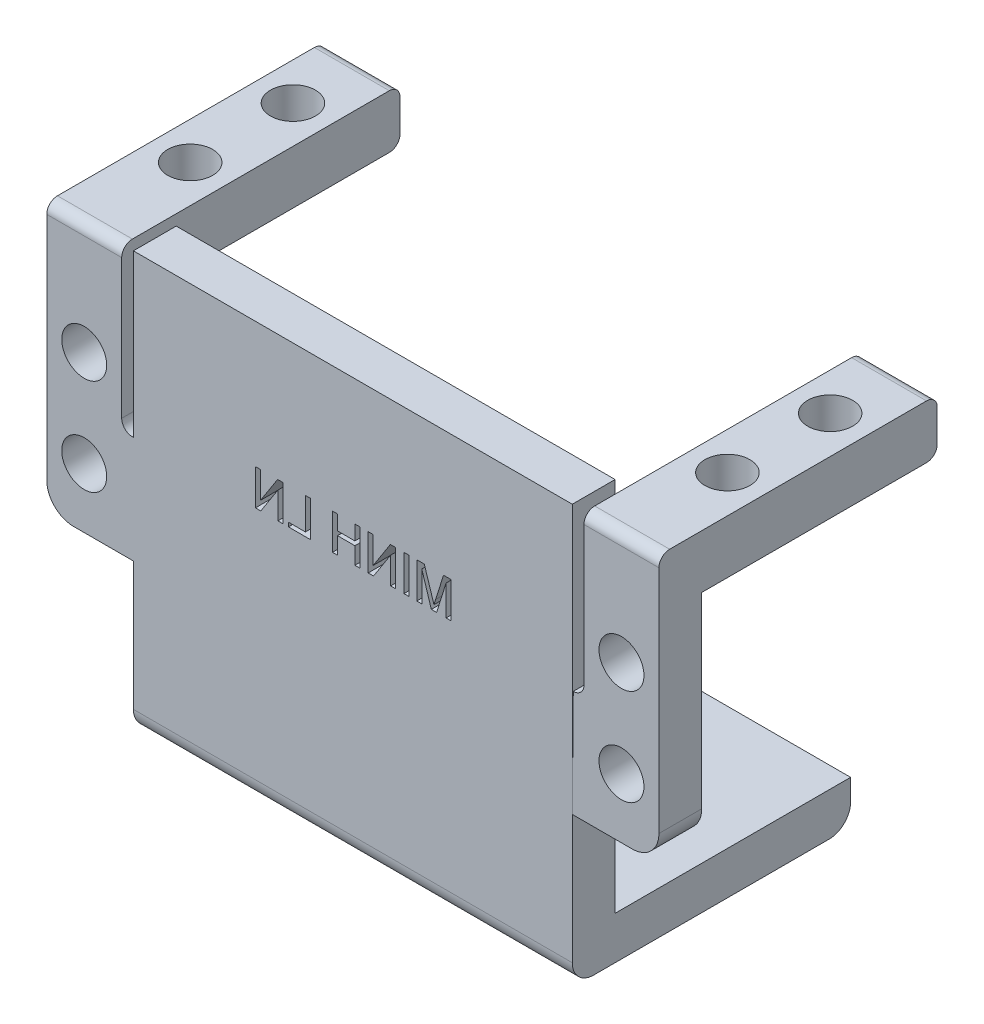
from build123d import *

# Parameters (mm, degrees)
SKETCH1_W            = 41
SKETCH1_H            = 37
BOSS_EXTRUDE2_DEPTH  = 4
BOSS_EXTRUDE5_DEPTH  = 7
BOSS_EXTRUDE6_START  = -7
BOSS_EXTRUDE6_DEPTH  = 7
BOSS_EXTRUDE7_DEPTH  = 41
SKETCH6_R            = 2.1
CUT_EXTRUDE1_DEPTH   = 41
VENT3_START          = -3
VENT3_DEPTH          = 3
VENT3_START_2        = -2
VENT3_2_DEPTH        = 2
SKETCH13_R           = 2.1
CUT_EXTRUDE4_DEPTH   = 41
WRAP2_START          = -4
WRAP2_OUTLINE_W      = 0.470858425
WRAP2_OUTLINE_H      = 3.33881429
WRAP2_DEPTH          = 4
SKETCH19_W           = 41
SKETCH19_H           = 4.905077857
CUT_EXTRUDE5_DEPTH   = 41
CUT_EXTRUDE10_DEPTH  = 49
BOSS_EXTRUDE8_DEPTH  = 41
CUT_EXTRUDE11_DEPTH  = 41
SKETCH25_W           = 4
SKETCH25_H           = 7
CUT_EXTRUDE12_DEPTH  = 41
BOSS_EXTRUDE10_DEPTH = 41
VENT5_START          = -7
VENT5_DEPTH          = 4


# Read off the part's stored shape, not the designer's step: Vent3, Wrap2, Vent5
with BuildPart() as part:
    # Sketch1 → Boss-Extrude2 (new body)
    with BuildSketch(Plane.XY):
        with BuildLine():
            Line((-5.593578953, 7), (0, 7))
            Line((0, 7), (0, 17))
            Line((0, 17), (-0.093578953, 17))
            ThreePointArc((-0.093578953, 17), (-0.800685735, 17.292893219), (-1.093578953, 18))
            Line((-1.093578953, 18), (-1.093578953, 27))
            Line((-1.093578953, 27), (-8.093578953, 27))
            Line((-8.093578953, 27), (-8.093578953, 9.5))
            ThreePointArc((-8.093578953, 9.5), (-7.361345906, 7.732233047), (-5.593578953, 7))
        make_face()
        with Locations((20.5, 18.5)):
            Rectangle(SKETCH1_W, SKETCH1_H)
        with BuildLine():
            Line((42.093578953, 27), (42.093578953, 18))
            ThreePointArc((42.093578953, 18), (41.800685735, 17.292893219), (41.093578953, 17))
            Line((41.093578953, 17), (41, 7))
            Line((41, 7), (46.593578953, 7))
            ThreePointArc((46.593578953, 7), (48.361345906, 7.732233047), (49.093578953, 9.5))
            Line((49.093578953, 9.5), (49.093578953, 27))
            Line((49.093578953, 27), (42.093578953, 27))
        make_face()
    extrude(amount=BOSS_EXTRUDE2_DEPTH)

    # Sketch3 → Boss-Extrude5 (add)
    with BuildSketch(Plane.ZY.offset(8.093578953)):
        with BuildLine():
            Line((4, 27), (4, 31))
            ThreePointArc((4, 31), (3.707106781, 31.707106781), (3, 32))
            Line((3, 32), (-21, 32))
            ThreePointArc((-21, 32), (-21.707106781, 31.707106781), (-22, 31))
            Line((-22, 31), (-22, 28))
            ThreePointArc((-22, 28), (-21.707106781, 27.292893219), (-21, 27))
            Line((-21, 27), (4, 27))
        make_face()
    extrude(amount=-BOSS_EXTRUDE5_DEPTH)

    # Sketch4 → Boss-Extrude6 (add)
    with BuildSketch(Plane(origin=(49.093578953, 0, 0), x_dir=(0, 0, -1), z_dir=(1, 0, 0)).offset(BOSS_EXTRUDE6_START)):
        with BuildLine():
            Line((-4, 27), (-4, 31))
            ThreePointArc((-4, 31), (-3.707106781, 31.707106781), (-3, 32))
            Line((-3, 32), (21, 32))
            ThreePointArc((21, 32), (21.707106781, 31.707106781), (22, 31))
            Line((22, 31), (22, 28))
            ThreePointArc((22, 28), (21.707106781, 27.292893219), (21, 27))
            Line((21, 27), (-4, 27))
        make_face()
    extrude(amount=BOSS_EXTRUDE6_DEPTH)

    # Sketch5 → Boss-Extrude7 (add)
    with BuildSketch(Plane(origin=(41, 0, 0), x_dir=(0, 0, -1), z_dir=(1, 0, 0))):
        with BuildLine():
            Line((-4, 0), (-4, -2))
            ThreePointArc((-4, -2), (-3.707106781, -2.707106781), (-3, -3))
            Line((-3, -3), (21, -3))
            ThreePointArc((21, -3), (21.707106781, -2.707106781), (22, -2))
            Line((22, -2), (22, 0))
            Line((22, 0), (-4, 0))
        make_face()
    extrude(amount=-BOSS_EXTRUDE7_DEPTH)

    # Sketch6 → Cut-Extrude1 (cut)
    with BuildSketch(Plane(origin=(0, 0, 0), x_dir=(-1, 0, 0), z_dir=(0, 0, -1))):
        with Locations((-45.593578953, 21.584624203)):
            Circle(SKETCH6_R)
        with Locations((-45.593578953, 12.584624203)):
            Circle(SKETCH6_R)
        with Locations(Location((4.593578953, 12.584624203, 0), (0, 0, 180))):
            Circle(SKETCH6_R)
        with Locations(Location((4.593578953, 21.584624203, 0), (0, 0, 180))):
            Circle(SKETCH6_R)
    extrude(amount=-CUT_EXTRUDE1_DEPTH, mode=Mode.SUBTRACT)

    # Vent3 outline → Vent3 (cut)
    with BuildSketch(Plane(origin=(0, 0, 0), x_dir=(1, 0, 0), z_dir=(0, 1, 0)).offset(VENT3_START)):
        with BuildLine():
            add(Edge.make_bspline(
                [(26.254292758, 14.292229622), (26.490329769, 14.024628481), (27.028597409, 13.325420144), (27.693645718, 12.081202271), (28.103180437, 10.731147229), (28.216982696, 9.856119597), (28.239301908, 9.499993666)],
                knots=[0.884953607, 0.884953607, 0.884953607, 0.884953607, 0.90625, 0.9375, 0.96875, 0.990046392, 0.990046392, 0.990046392, 0.990046392], degree=3))
            Line((26.254292758, 14.292229622), (25.191078107, 13.229005937))
            add(Edge.make_bspline(
                [(25.191078107, 13.229005937), (25.359316582, 13.032624281), (25.773380785, 12.486641347), (26.298893159, 11.503476846), (26.622502084, 10.436681188), (26.715782713, 9.75782534), (26.735682947, 9.499999964)],
                knots=[0.88725486, 0.88725486, 0.88725486, 0.88725486, 0.90625, 0.9375, 0.96875, 0.987745141, 0.987745141, 0.987745141, 0.987745141], degree=3))
            Line((26.735682947, 9.499999964), (28.239301908, 9.499993666))
        make_face()
        with BuildLine():
            add(Edge.make_bspline(
                [(20.754959005, 16.984336506), (21.111084958, 16.962017296), (21.986112614, 16.848215038), (23.336167677, 16.438680312), (24.580385232, 15.773632174), (25.279593317, 15.235364802), (25.547194221, 14.999328063)],
                knots=[0.759953607, 0.759953607, 0.759953607, 0.759953607, 0.78125, 0.8125, 0.84375, 0.865046372, 0.865046372, 0.865046372, 0.865046372], degree=3))
            Line((20.754959005, 16.984336506), (20.754965394, 15.48071754))
            add(Edge.make_bspline(
                [(20.754965394, 15.48071754), (21.012790761, 15.460817306), (21.691646601, 15.367536676), (22.758442251, 15.043927754), (23.741606759, 14.518415376), (24.287589698, 14.104351168), (24.48397136, 13.936112687)],
                knots=[0.76225486, 0.76225486, 0.76225486, 0.76225486, 0.78125, 0.8125, 0.84375, 0.86274514, 0.86274514, 0.86274514, 0.86274514], degree=3))
            Line((24.48397136, 13.936112687), (25.547194221, 14.999328063))
        make_face()
        with BuildLine():
            add(Edge.make_bspline(
                [(14.962735784, 14.999327352), (15.230336925, 15.235364364), (15.929545262, 15.773632004), (17.173763134, 16.438680312), (18.523817853, 16.848214934), (19.39884514, 16.962017204), (19.754970732, 16.984336439)],
                knots=[0.634953607, 0.634953607, 0.634953607, 0.634953607, 0.65625, 0.6875, 0.71875, 0.740046372, 0.740046372, 0.740046372, 0.740046372], degree=3))
            Line((14.962735784, 14.999327352), (16.025959469, 13.936112702))
            add(Edge.make_bspline(
                [(16.025959469, 13.936112702), (16.222341125, 14.104351177), (16.768324058, 14.518415379), (17.75148856, 15.043927754), (18.818284217, 15.367536678), (19.497140065, 15.460817308), (19.754965439, 15.480717542)],
                knots=[0.63725486, 0.63725486, 0.63725486, 0.63725486, 0.65625, 0.6875, 0.71875, 0.73774514, 0.73774514, 0.73774514, 0.73774514], degree=3))
            Line((19.754965439, 15.480717542), (19.754970732, 16.984336439))
        make_face()
        with BuildLine():
            add(Edge.make_bspline(
                [(12.270628899, 9.4999936), (12.292948109, 9.856119553), (12.406750367, 10.731147208), (12.816285093, 12.081202271), (13.481333232, 13.325419826), (14.019600604, 14.024627911), (14.255637342, 14.292228815)],
                knots=[0.509953607, 0.509953607, 0.509953607, 0.509953607, 0.53125, 0.5625, 0.59375, 0.615046372, 0.615046372, 0.615046372, 0.615046372], degree=3))
            Line((12.270628899, 9.4999936), (13.774247864, 9.499999971))
            add(Edge.make_bspline(
                [(13.774247864, 9.499999971), (13.794148098, 9.757825344), (13.887428728, 10.43668119), (14.211037652, 11.503476846), (14.73655003, 12.486641354), (15.150614238, 13.032624293), (15.318852718, 13.229005954)],
                knots=[0.51225486, 0.51225486, 0.51225486, 0.51225486, 0.53125, 0.5625, 0.59375, 0.61274514, 0.61274514, 0.61274514, 0.61274514], degree=3))
            Line((15.318852718, 13.229005954), (14.255637342, 14.292228815))
        make_face()
        with BuildLine():
            add(Edge.make_bspline(
                [(14.255638053, 3.707770378), (14.019601042, 3.975371519), (13.481333402, 4.674579856), (12.816285093, 5.918797729), (12.406750472, 7.268852447), (12.292948202, 8.143879735), (12.270628966, 8.500005327)],
                knots=[0.384953607, 0.384953607, 0.384953607, 0.384953607, 0.40625, 0.4375, 0.46875, 0.490046372, 0.490046372, 0.490046372, 0.490046372], degree=3))
            Line((14.255638053, 3.707770378), (15.318852715, 4.77099405))
            add(Edge.make_bspline(
                [(15.318852715, 4.77099405), (15.150614236, 4.96737571), (14.736550029, 5.513358648), (14.211037652, 6.496523154), (13.887428727, 7.563318811), (13.794148098, 8.242174659), (13.774247864, 8.500000034)],
                knots=[0.38725486, 0.38725486, 0.38725486, 0.38725486, 0.40625, 0.4375, 0.46875, 0.48774514, 0.48774514, 0.48774514, 0.48774514], degree=3))
            Line((13.774247864, 8.500000034), (12.270628966, 8.500005327))
        make_face()
        with BuildLine():
            add(Edge.make_bspline(
                [(19.754971805, 1.015663494), (19.398845853, 1.037982704), (18.523818197, 1.151784962), (17.173763134, 1.561319688), (15.929545579, 2.226367826), (15.230337494, 2.764635198), (14.96273659, 3.000671937)],
                knots=[0.259953607, 0.259953607, 0.259953607, 0.259953607, 0.28125, 0.3125, 0.34375, 0.365046372, 0.365046372, 0.365046372, 0.365046372], degree=3))
            Line((19.754971805, 1.015663494), (19.754965434, 2.519282459))
            add(Edge.make_bspline(
                [(19.754965434, 2.519282459), (19.497140061, 2.539182693), (18.818284215, 2.632463322), (17.75148856, 2.956072246), (16.768324057, 3.481584622), (16.222341122, 3.895648825), (16.025959465, 4.063887302)],
                knots=[0.26225486, 0.26225486, 0.26225486, 0.26225486, 0.28125, 0.3125, 0.34375, 0.36274514, 0.36274514, 0.36274514, 0.36274514], degree=3))
            Line((16.025959465, 4.063887302), (14.96273659, 3.000671937))
        make_face()
        with BuildLine():
            add(Edge.make_bspline(
                [(25.547195027, 3.000672648), (25.279593886, 2.764635636), (24.580385549, 2.226367996), (23.336167677, 1.561319688), (21.986112958, 1.151785066), (21.111085671, 1.037982796), (20.754960079, 1.015663561)],
                knots=[0.134953607, 0.134953607, 0.134953607, 0.134953607, 0.15625, 0.1875, 0.21875, 0.240046372, 0.240046372, 0.240046372, 0.240046372], degree=3))
            Line((25.547195027, 3.000672648), (24.483971356, 4.063887309))
            add(Edge.make_bspline(
                [(24.483971356, 4.063887309), (24.287589695, 3.89564883), (23.741606758, 3.481584624), (22.758442251, 2.956072246), (21.6916466, 2.632463323), (21.012790758, 2.539182694), (20.754965389, 2.51928246)],
                knots=[0.13725486, 0.13725486, 0.13725486, 0.13725486, 0.15625, 0.1875, 0.21875, 0.23774514, 0.23774514, 0.23774514, 0.23774514], degree=3))
            Line((20.754965389, 2.51928246), (20.754960079, 1.015663561))
        make_face()
        with BuildLine():
            add(Edge.make_bspline(
                [(28.239301849, 8.500005394), (28.216982615, 8.143879779), (28.103180346, 7.268852469), (27.693645718, 5.918797729), (27.028597579, 4.674580174), (26.490330207, 3.975372089), (26.254293469, 3.707771185)],
                knots=[0.009953627, 0.009953627, 0.009953627, 0.009953627, 0.03125, 0.0625, 0.09375, 0.115046372, 0.115046372, 0.115046372, 0.115046372], degree=3))
            Line((28.239301849, 8.500005394), (26.735682947, 8.500000028))
            add(Edge.make_bspline(
                [(26.735682947, 8.500000028), (26.715782713, 8.242174655), (26.622502083, 7.56331881), (26.298893159, 6.496523154), (25.773380784, 5.513358651), (25.35931658, 4.967375716), (25.191078104, 4.770994059)],
                knots=[0.01225486, 0.01225486, 0.01225486, 0.01225486, 0.03125, 0.0625, 0.09375, 0.11274514, 0.11274514, 0.11274514, 0.11274514], degree=3))
            Line((25.191078104, 4.770994059), (26.254293469, 3.707771185))
        make_face()
        with BuildLine():
            add(Edge.make_bspline(
                [(23.719578667, 8.5), (23.710818691, 8.438795946), (23.661877779, 8.151934077), (23.508858699, 7.652344268), (23.263786163, 7.190727584), (23.09555819, 6.953268745), (23.058387959, 6.903684228)],
                knots=[0.022808357, 0.022808357, 0.022808357, 0.022808357, 0.031243519, 0.062499749, 0.093737042, 0.102191544, 0.102191544, 0.102191544, 0.102191544], degree=3))
            Line((23.719578667, 8.5), (22.191357776, 8.50004854))
            add(Edge.make_bspline(
                [(22.191357776, 8.50004854), (22.168050259, 8.409645315), (22.108840924, 8.232097408), (22.02516265, 8.064684867), (21.977717536, 7.984277617)],
                knots=[0.040212611, 0.040212611, 0.040212611, 0.040212611, 0.0625, 0.084787876, 0.084787876, 0.084787876, 0.084787876], degree=3))
            Line((21.977717536, 7.984277617), (23.058387959, 6.903684228))
        make_face()
        with BuildLine():
            Line((25.732169626, 8.500000021), (24.727084946, 8.500005812))
            add(Edge.make_bspline(
                [(24.727084946, 8.500005812), (24.712919427, 8.373280452), (24.648235027, 7.955843767), (24.439223081, 7.266823722), (24.099805769, 6.631818594), (23.850371742, 6.290906996), (23.770779433, 6.191281592)],
                knots=[0.017720318, 0.017720318, 0.017720318, 0.017720318, 0.03125, 0.0625, 0.09375, 0.107279756, 0.107279756, 0.107279756, 0.107279756], degree=3))
            Line((23.770779433, 6.191281592), (24.481487035, 5.480585138))
            add(Edge.make_bspline(
                [(25.732169626, 8.500000021), (25.714614891, 8.307722769), (25.635375377, 7.759603777), (25.36905812, 6.881673438), (24.936582364, 6.072568207), (24.605034509, 5.628958757), (24.481487035, 5.480585138)],
                knots=[0.014488699, 0.014488699, 0.014488699, 0.014488699, 0.03125, 0.0625, 0.09375, 0.110511301, 0.110511301, 0.110511301, 0.110511301], degree=3))
        make_face()
        with BuildLine():
            add(Edge.make_bspline(
                [(23.058389576, 11.096317403), (23.095447527, 11.046882155), (23.263690757, 10.809436942), (23.508738524, 10.347907918), (23.661914695, 9.848167792), (23.710860564, 9.561300711), (23.71963087, 9.5)],
                knots=[0.897807983, 0.897807983, 0.897807983, 0.897807983, 0.906237042, 0.937499748, 0.968743523, 0.977191918, 0.977191918, 0.977191918, 0.977191918], degree=3))
            Line((23.058389576, 11.096317403), (21.977719483, 10.015719084))
            add(Edge.make_bspline(
                [(21.977719483, 10.015719084), (22.025163794, 9.935312843), (22.108842588, 9.767898861), (22.16805204, 9.590349345), (22.191359879, 9.499943302)],
                knots=[0.915212428, 0.915212428, 0.915212428, 0.915212428, 0.9375, 0.959788059, 0.959788059, 0.959788059, 0.959788059], degree=3))
            Line((22.191359879, 9.499943302), (23.71963087, 9.5))
        make_face()
        with BuildLine():
            Line((24.48148704, 12.519414856), (23.770779936, 11.808717778))
            add(Edge.make_bspline(
                [(23.770779936, 11.808717778), (23.850372059, 11.70909257), (24.099805896, 11.368181168), (24.439223081, 10.733176278), (24.648235356, 10.044155147), (24.712919773, 9.626717314), (24.727085322, 9.499990821)],
                knots=[0.892720273, 0.892720273, 0.892720273, 0.892720273, 0.90625, 0.9375, 0.96875, 0.982279802, 0.982279802, 0.982279802, 0.982279802], degree=3))
            Line((24.727085322, 9.499990821), (25.732169627, 9.499999973))
            add(Edge.make_bspline(
                [(24.48148704, 12.519414856), (24.605034512, 12.371041239), (24.936582365, 11.92743179), (25.36905812, 11.118326562), (25.635375377, 10.240396221), (25.714614891, 9.692277227), (25.732169627, 9.499999973)],
                knots=[0.889488699, 0.889488699, 0.889488699, 0.889488699, 0.90625, 0.9375, 0.96875, 0.985511301, 0.985511301, 0.985511301, 0.985511301], degree=3))
        make_face()
        with BuildLine():
            add(Edge.make_bspline(
                [(20.754965395, 12.464639674), (20.816125233, 12.455887713), (21.102990751, 12.406955608), (21.602575841, 12.253904173), (22.064238, 12.008820256), (22.301697051, 11.840593302), (22.351281681, 11.803423056)],
                knots=[0.772808003, 0.772808003, 0.772808003, 0.772808003, 0.781237042, 0.812499748, 0.843737042, 0.852191567, 0.852191567, 0.852191567, 0.852191567], degree=3))
            Line((20.754965395, 12.464639674), (20.754914644, 10.936392943))
            add(Edge.make_bspline(
                [(20.754914644, 10.936392943), (20.845318636, 10.913085339), (21.022867311, 10.853875862), (21.190280535, 10.770197246), (21.270687785, 10.722752133)],
                knots=[0.790212428, 0.790212428, 0.790212428, 0.790212428, 0.8125, 0.834787876, 0.834787876, 0.834787876, 0.834787876], degree=3))
            Line((21.270687785, 10.722752133), (22.351281681, 11.803423056))
        make_face()
        with BuildLine():
            Line((20.754965404, 14.477204219), (20.754958314, 13.472119683))
            add(Edge.make_bspline(
                [(20.754958314, 13.472119683), (20.881684104, 13.457954153), (21.299121226, 13.393269746), (21.988141683, 13.184257676), (22.623146811, 12.844840363), (22.96405841, 12.595406336), (23.063683814, 12.515814027)],
                knots=[0.767720273, 0.767720273, 0.767720273, 0.767720273, 0.78125, 0.8125, 0.84375, 0.857279756, 0.857279756, 0.857279756, 0.857279756], degree=3))
            Line((23.063683814, 12.515814027), (23.774380281, 13.226521618))
            add(Edge.make_bspline(
                [(20.754965404, 14.477204219), (20.947242649, 14.459649483), (21.495361634, 14.38040997), (22.373291967, 14.114092715), (23.182397203, 13.681616956), (23.626006658, 13.350069096), (23.774380281, 13.226521618)],
                knots=[0.764488699, 0.764488699, 0.764488699, 0.764488699, 0.78125, 0.8125, 0.84375, 0.860511302, 0.860511302, 0.860511302, 0.860511302], degree=3))
        make_face()
        with BuildLine():
            add(Edge.make_bspline(
                [(18.158648582, 11.80342359), (18.208083688, 11.840481555), (18.445528467, 12.008725889), (18.907012207, 12.253762237), (19.40675702, 12.406905983), (19.693620444, 12.455860681), (19.754965405, 12.464639016)],
                knots=[0.647808003, 0.647808003, 0.647808003, 0.647808003, 0.656237042, 0.687499749, 0.718737042, 0.727191564, 0.727191564, 0.727191564, 0.727191564], degree=3))
            Line((18.158648582, 11.80342359), (19.239246321, 10.722754077))
            add(Edge.make_bspline(
                [(19.239246321, 10.722754077), (19.319652562, 10.770198389), (19.487065856, 10.853876838), (19.6646146, 10.913086147), (19.755019872, 10.936393898)],
                knots=[0.665212428, 0.665212428, 0.665212428, 0.665212428, 0.6875, 0.709787876, 0.709787876, 0.709787876, 0.709787876], degree=3))
            Line((19.755019872, 10.936393898), (19.754965405, 12.464639016))
        make_face()
        with BuildLine():
            Line((16.73555055, 13.226521635), (17.446253199, 12.515818982))
            add(Edge.make_bspline(
                [(17.446253199, 12.515818982), (17.545876676, 12.595409464), (17.886786344, 12.844841616), (18.521789128, 13.184257676), (19.210809843, 13.393269825), (19.628247238, 13.457954236), (19.754973298, 13.472119773)],
                knots=[0.642720525, 0.642720525, 0.642720525, 0.642720525, 0.65625, 0.6875, 0.71875, 0.732279756, 0.732279756, 0.732279756, 0.732279756], degree=3))
            Line((19.754973298, 13.472119773), (19.754965433, 14.477204222))
            add(Edge.make_bspline(
                [(16.73555055, 13.226521635), (16.883924167, 13.350069106), (17.327533615, 13.68161696), (18.136638844, 14.114092715), (19.014569185, 14.380409972), (19.562688179, 14.459649486), (19.754965433, 14.477204222)],
                knots=[0.639488699, 0.639488699, 0.639488699, 0.639488699, 0.65625, 0.6875, 0.71875, 0.735511302, 0.735511302, 0.735511302, 0.735511302], degree=3))
        make_face()
        with BuildLine():
            add(Edge.make_bspline(
                [(16.790325734, 9.5), (16.799077695, 9.561159834), (16.848009799, 9.848025353), (17.001061216, 10.347610495), (17.24614518, 10.809272421), (17.414372054, 11.046731693), (17.451542272, 11.096316352)],
                knots=[0.522808004, 0.522808004, 0.522808004, 0.522808004, 0.531237042, 0.562499749, 0.593737042, 0.602191564, 0.602191564, 0.602191564, 0.602191564], degree=3))
            Line((16.790325734, 9.5), (18.318572464, 9.499949242))
            add(Edge.make_bspline(
                [(18.318572464, 9.499949242), (18.341880068, 9.590353234), (18.401089544, 9.767901907), (18.48476816, 9.93531513), (18.532213272, 10.01572238)],
                knots=[0.540212429, 0.540212429, 0.540212429, 0.540212429, 0.5625, 0.584787876, 0.584787876, 0.584787876, 0.584787876], degree=3))
            Line((18.532213272, 10.01572238), (17.451542272, 11.096316352))
        make_face()
        with BuildLine():
            Line((14.777761185, 9.499999981), (15.782845722, 9.499992908))
            add(Edge.make_bspline(
                [(15.782845722, 9.499992908), (15.797011252, 9.626718699), (15.861695659, 10.044155821), (16.07070773, 10.733176278), (16.410125042, 11.368181406), (16.659559069, 11.709093004), (16.739151378, 11.808718408)],
                knots=[0.517720273, 0.517720273, 0.517720273, 0.517720273, 0.53125, 0.5625, 0.59375, 0.607279756, 0.607279756, 0.607279756, 0.607279756], degree=3))
            Line((16.739151378, 11.808718408), (16.028443787, 12.519414876))
            add(Edge.make_bspline(
                [(14.777761185, 9.499999981), (14.79531592, 9.692277232), (14.874555434, 10.240396223), (15.140872691, 11.118326562), (15.57334845, 11.927431798), (15.90489631, 12.371041253), (16.028443787, 12.519414876)],
                knots=[0.514488699, 0.514488699, 0.514488699, 0.514488699, 0.53125, 0.5625, 0.59375, 0.610511302, 0.610511302, 0.610511302, 0.610511302], degree=3))
        make_face()
        with BuildLine():
            add(Edge.make_bspline(
                [(17.451541809, 6.903683185), (17.414483847, 6.953118288), (17.246239515, 7.190563065), (17.001203168, 7.652046802), (16.848059423, 8.151791613), (16.799104725, 8.438655038), (16.790326389, 8.5)],
                knots=[0.397808004, 0.397808004, 0.397808004, 0.397808004, 0.406237042, 0.437499749, 0.468737042, 0.477191564, 0.477191564, 0.477191564, 0.477191564], degree=3))
            Line((17.451541809, 6.903683185), (18.532211326, 7.984280919))
            add(Edge.make_bspline(
                [(18.532211326, 7.984280919), (18.484767015, 8.06468716), (18.401088567, 8.232100452), (18.341879258, 8.409649195), (18.318571507, 8.500054467)],
                knots=[0.415212429, 0.415212429, 0.415212429, 0.415212429, 0.4375, 0.459787876, 0.459787876, 0.459787876, 0.459787876], degree=3))
            Line((18.318571507, 8.500054467), (16.790326389, 8.5))
        make_face()
        with BuildLine():
            Line((16.028443782, 5.48058513), (16.739150875, 6.191282222))
            add(Edge.make_bspline(
                [(16.739150875, 6.191282222), (16.659558752, 6.29090743), (16.410124915, 6.631818832), (16.07070773, 7.266823722), (15.861695581, 7.955844438), (15.79701117, 8.373281833), (15.782845632, 8.500007893)],
                knots=[0.392720273, 0.392720273, 0.392720273, 0.392720273, 0.40625, 0.4375, 0.46875, 0.482279756, 0.482279756, 0.482279756, 0.482279756], degree=3))
            Line((15.782845632, 8.500007893), (14.777761184, 8.500000027))
            add(Edge.make_bspline(
                [(16.028443782, 5.48058513), (15.904896306, 5.628958751), (15.573348449, 6.072568204), (15.140872691, 6.881673438), (14.874555433, 7.759603779), (14.79531592, 8.307722773), (14.777761184, 8.500000027)],
                knots=[0.389488699, 0.389488699, 0.389488699, 0.389488699, 0.40625, 0.4375, 0.46875, 0.485511302, 0.485511302, 0.485511302, 0.485511302], degree=3))
        make_face()
        with BuildLine():
            add(Edge.make_bspline(
                [(19.754965405, 5.535360329), (19.693805572, 5.544112289), (19.406940051, 5.593044394), (18.907354911, 5.746095811), (18.445692985, 5.991179775), (18.208233712, 6.159406649), (18.158649053, 6.196576867)],
                knots=[0.272808004, 0.272808004, 0.272808004, 0.272808004, 0.281237042, 0.312499749, 0.343737042, 0.352191564, 0.352191564, 0.352191564, 0.352191564], degree=3))
            Line((19.754965405, 5.535360329), (19.755016163, 7.063607058))
            add(Edge.make_bspline(
                [(19.755016163, 7.063607058), (19.664612172, 7.086914662), (19.487063498, 7.146124139), (19.319650273, 7.229802756), (19.239243022, 7.277247869)],
                knots=[0.290212429, 0.290212429, 0.290212429, 0.290212429, 0.3125, 0.334787876, 0.334787876, 0.334787876, 0.334787876], degree=3))
            Line((19.239243022, 7.277247869), (18.158649053, 6.196576867))
        make_face()
        with BuildLine():
            Line((19.754965425, 3.522795779), (19.754972497, 4.527880317))
            add(Edge.make_bspline(
                [(19.754972497, 4.527880317), (19.628246707, 4.542045847), (19.210809585, 4.606730254), (18.521789128, 4.815742324), (17.886784, 5.155159637), (17.545872401, 5.404593664), (17.446246997, 5.484185973)],
                knots=[0.267720273, 0.267720273, 0.267720273, 0.267720273, 0.28125, 0.3125, 0.34375, 0.357279756, 0.357279756, 0.357279756, 0.357279756], degree=3))
            Line((17.446246997, 5.484185973), (16.735550544, 4.77347837))
            add(Edge.make_bspline(
                [(19.754965425, 3.522795779), (19.562688174, 3.540350515), (19.014569182, 3.619590029), (18.136638844, 3.885907285), (17.327533613, 4.318383041), (16.883924162, 4.649930897), (16.735550544, 4.77347837)],
                knots=[0.264488699, 0.264488699, 0.264488699, 0.264488699, 0.28125, 0.3125, 0.34375, 0.360511301, 0.360511301, 0.360511301, 0.360511301], degree=3))
        make_face()
        with BuildLine():
            Line((23.774380275, 4.773478377), (23.063683184, 5.484185469))
            add(Edge.make_bspline(
                [(23.063683184, 5.484185469), (22.964057976, 5.404593346), (22.623146573, 5.15515951), (21.988141683, 4.815742324), (21.299120968, 4.606730175), (20.881683573, 4.542045764), (20.754957513, 4.527880227)],
                knots=[0.142720273, 0.142720273, 0.142720273, 0.142720273, 0.15625, 0.1875, 0.21875, 0.232279756, 0.232279756, 0.232279756, 0.232279756], degree=3))
            Line((20.754957513, 4.527880227), (20.754965396, 3.52279578))
            add(Edge.make_bspline(
                [(23.774380275, 4.773478377), (23.626006654, 4.649930901), (23.182397201, 4.318383043), (22.373291967, 3.885907285), (21.495361632, 3.61959003), (20.947242644, 3.540350516), (20.754965396, 3.52279578)],
                knots=[0.139488699, 0.139488699, 0.139488699, 0.139488699, 0.15625, 0.1875, 0.21875, 0.235511301, 0.235511301, 0.235511301, 0.235511301], degree=3))
        make_face()
        with BuildLine():
            add(Edge.make_bspline(
                [(22.351282297, 6.196576327), (22.301847165, 6.159518392), (22.064402168, 5.99127414), (21.602918663, 5.746237747), (21.103173796, 5.593094017), (20.816310366, 5.544139321), (20.754965405, 5.535360986)],
                knots=[0.147808007, 0.147808007, 0.147808007, 0.147808007, 0.156237042, 0.187499749, 0.218737042, 0.227191564, 0.227191564, 0.227191564, 0.227191564], degree=3))
            Line((22.351282297, 6.196576327), (21.270684486, 7.27724592))
            add(Edge.make_bspline(
                [(21.270684486, 7.27724592), (21.190278246, 7.22980161), (21.022864952, 7.146123161), (20.845316208, 7.086913852), (20.754910934, 7.063606101)],
                knots=[0.165212429, 0.165212429, 0.165212429, 0.165212429, 0.1875, 0.209787876, 0.209787876, 0.209787876, 0.209787876], degree=3))
            Line((20.754910934, 7.063606101), (20.754965405, 5.535360986))
        make_face()
    extrude(amount=VENT3_DEPTH, mode=Mode.SUBTRACT)

    # Vent3 2 outline → Vent3 2 (cut)
    with BuildSketch(Plane(origin=(0, 0, 0), x_dir=(1, 0, 0), z_dir=(0, 1, 0)).offset(VENT3_START_2)):
        with BuildLine():
            add(Edge.make_bspline(
                [(22.191357776, 8.50004854), (22.168050259, 8.409645315), (22.108840924, 8.232097408), (22.02516265, 8.064684867), (21.977717536, 7.984277617)],
                knots=[0.040212611, 0.040212611, 0.040212611, 0.040212611, 0.0625, 0.084787876, 0.084787876, 0.084787876, 0.084787876], degree=3))
            Line((22.191357776, 8.50004854), (21.462072187, 8.5))
            Line((21.462072187, 8.5), (21.977717536, 7.984277617))
        make_face()
        with BuildLine():
            add(Edge.make_bspline(
                [(21.977719483, 10.015719084), (22.025163794, 9.935312843), (22.108842588, 9.767898861), (22.16805204, 9.590349345), (22.191359879, 9.499943302)],
                knots=[0.915212428, 0.915212428, 0.915212428, 0.915212428, 0.9375, 0.959788059, 0.959788059, 0.959788059, 0.959788059], degree=3))
            Line((21.977719483, 10.015719084), (21.462072187, 9.5))
            Line((21.462072187, 9.5), (22.191359879, 9.499943302))
        make_face()
        with BuildLine():
            add(Edge.make_bspline(
                [(20.754914644, 10.936392943), (20.845318636, 10.913085339), (21.022867311, 10.853875862), (21.190280535, 10.770197246), (21.270687785, 10.722752133)],
                knots=[0.790212428, 0.790212428, 0.790212428, 0.790212428, 0.8125, 0.834787876, 0.834787876, 0.834787876, 0.834787876], degree=3))
            Line((20.754914644, 10.936392943), (20.754965405, 10.207106781))
            Line((20.754965405, 10.207106781), (21.270687785, 10.722752133))
        make_face()
        with BuildLine():
            add(Edge.make_bspline(
                [(19.239246321, 10.722754077), (19.319652562, 10.770198389), (19.487065856, 10.853876838), (19.6646146, 10.913086147), (19.755019872, 10.936393898)],
                knots=[0.665212428, 0.665212428, 0.665212428, 0.665212428, 0.6875, 0.709787876, 0.709787876, 0.709787876, 0.709787876], degree=3))
            Line((19.239246321, 10.722754077), (19.754965405, 10.207106781))
            Line((19.754965405, 10.207106781), (19.755019872, 10.936393898))
        make_face()
        with BuildLine():
            add(Edge.make_bspline(
                [(18.318572464, 9.499949242), (18.341880068, 9.590353234), (18.401089544, 9.767901907), (18.48476816, 9.93531513), (18.532213272, 10.01572238)],
                knots=[0.540212429, 0.540212429, 0.540212429, 0.540212429, 0.5625, 0.584787876, 0.584787876, 0.584787876, 0.584787876], degree=3))
            Line((18.318572464, 9.499949242), (19.047858624, 9.5))
            Line((19.047858624, 9.5), (18.532213272, 10.01572238))
        make_face()
        with BuildLine():
            add(Edge.make_bspline(
                [(18.532211326, 7.984280919), (18.484767015, 8.06468716), (18.401088567, 8.232100452), (18.341879258, 8.409649195), (18.318571507, 8.500054467)],
                knots=[0.415212429, 0.415212429, 0.415212429, 0.415212429, 0.4375, 0.459787876, 0.459787876, 0.459787876, 0.459787876], degree=3))
            Line((18.532211326, 7.984280919), (19.047858624, 8.5))
            Line((19.047858624, 8.5), (18.318571507, 8.500054467))
        make_face()
        with BuildLine():
            add(Edge.make_bspline(
                [(19.755016163, 7.063607058), (19.664612172, 7.086914662), (19.487063498, 7.146124139), (19.319650273, 7.229802756), (19.239243022, 7.277247869)],
                knots=[0.290212429, 0.290212429, 0.290212429, 0.290212429, 0.3125, 0.334787876, 0.334787876, 0.334787876, 0.334787876], degree=3))
            Line((19.755016163, 7.063607058), (19.754965405, 7.792893219))
            Line((19.754965405, 7.792893219), (19.239243022, 7.277247869))
        make_face()
        with BuildLine():
            add(Edge.make_bspline(
                [(21.270684486, 7.27724592), (21.190278246, 7.22980161), (21.022864952, 7.146123161), (20.845316208, 7.086913852), (20.754910934, 7.063606101)],
                knots=[0.165212429, 0.165212429, 0.165212429, 0.165212429, 0.1875, 0.209787876, 0.209787876, 0.209787876, 0.209787876], degree=3))
            Line((21.270684486, 7.27724592), (20.754965405, 7.792893219))
            Line((20.754965405, 7.792893219), (20.754910934, 7.063606101))
        make_face()
    extrude(amount=VENT3_2_DEPTH, mode=Mode.SUBTRACT)

    # Sketch13 → Cut-Extrude4 (cut)
    with BuildSketch(Plane(origin=(0, 27, 0), x_dir=(-1, 0, 0), z_dir=(0, -1, 0))):
        with Locations(Location((4.593578953, 5.9, 0), (0, 0, 90))):
            Circle(SKETCH13_R)
        with Locations(Location((4.593578953, 15.5, 0), (0, 0, 90))):
            Circle(SKETCH13_R)
        with Locations(Location((-45.593578953, 5.9, 0), (0, 0, 90))):
            Circle(SKETCH13_R)
        with Locations(Location((-45.593578953, 15.5, 0), (0, 0, 90))):
            Circle(SKETCH13_R)
    extrude(amount=-CUT_EXTRUDE4_DEPTH, mode=Mode.SUBTRACT)

    # Wrap2 outline → Wrap2 (cut)
    with BuildSketch(Plane(origin=(0, 0, 0), x_dir=(-1, 0, 0), z_dir=(0, 0, -1)).offset(WRAP2_START)):
        with BuildLine():
            add(Edge.make_bspline(
                [(-28.227027543, 17.995892323), (-28.218813186, 17.969351101), (-28.202927096, 17.918021921), (-28.17936991, 17.843897862), (-28.15793682, 17.775016164), (-28.138632948, 17.711157574), (-28.120415634, 17.652639145), (-28.104642311, 17.598980691), (-28.089562501, 17.550778478), (-28.080725058, 17.520144395), (-28.07654012, 17.505637741)],
                knots=[0, 0, 0, 0, 0.162525522, 0.314314898, 0.454978491, 0.584519237, 0.704567103, 0.81349499, 0.91168126, 1, 1, 1, 1], degree=3))
            Line((-28.227027543, 17.995892323), (-28.974782827, 20.33881429))
            Line((-28.974782827, 20.33881429), (-29.681739299, 20.33881429))
            Line((-29.681739299, 20.33881429), (-29.681739299, 17))
            Line((-29.681739299, 17), (-29.210880873, 17))
            Line((-29.210880873, 17), (-29.210880873, 19.825150553))
            Line((-29.210880873, 19.825150553), (-28.32467716, 17))
            Line((-28.32467716, 17), (-27.833084912, 17))
            Line((-27.833084912, 17), (-26.942199368, 19.825150553))
            Line((-26.942199368, 19.825150553), (-26.942199368, 17))
            Line((-26.942199368, 17), (-26.471340942, 17))
            Line((-26.471340942, 17), (-26.471340942, 20.33881429))
            Line((-26.471340942, 20.33881429), (-27.173615583, 20.33881429))
            Line((-27.173615583, 20.33881429), (-27.912676038, 18.036022303))
            add(Edge.make_bspline(
                [(-28.07654012, 17.505637741), (-28.071879072, 17.521473022), (-28.061960063, 17.555171513), (-28.045879763, 17.608156613), (-28.028769866, 17.666790589), (-28.008294564, 17.730065618), (-27.986951485, 17.798974286), (-27.964549146, 17.873459367), (-27.938708484, 17.952777217), (-27.921536073, 18.007690184), (-27.912676038, 18.036022303)],
                knots=[0, 0, 0, 0, 0.08920477, 0.189833456, 0.299232592, 0.419260938, 0.54920739, 0.689074364, 0.839579198, 1, 1, 1, 1], degree=3))
        make_face()
        Polygon((-13.501331584, 19.491402891), (-11.90148307, 17), (-11.403871324, 17), (-11.403871324, 20.33881429), (-11.87472975, 20.33881429), (-11.87472975, 17.847411399), (-13.474578264, 20.33881429), (-13.972190009, 20.33881429), (-13.972190009, 17), (-13.501331584, 17), align=None)
        Polygon((-16.540508694, 20.33881429), (-16.540508694, 17), (-14.485853746, 17), (-14.485853746, 17.385247803), (-16.069650269, 17.385247803), (-16.069650269, 20.33881429), align=None)
        Polygon((-19.066022068, 18.583796522), (-19.066022068, 17), (-18.595163642, 17), (-18.595163642, 20.33881429), (-19.066022068, 20.33881429), (-19.066022068, 18.969044325), (-20.692623901, 18.969044325), (-20.692623901, 20.33881429), (-21.163482327, 20.33881429), (-21.163482327, 17), (-20.692623901, 17), (-20.692623901, 18.583796522), align=None)
        Polygon((-24.031438192, 19.491402891), (-22.431589678, 17), (-21.933977932, 17), (-21.933977932, 20.33881429), (-22.404836358, 20.33881429), (-22.404836358, 17.847411399), (-24.004684872, 20.33881429), (-24.502296617, 20.33881429), (-24.502296617, 17), (-24.031438192, 17), align=None)
        with Locations((-25.508221436, 18.669407145)):
            Rectangle(WRAP2_OUTLINE_W, WRAP2_OUTLINE_H)
    extrude(amount=WRAP2_DEPTH, mode=Mode.SUBTRACT)

    # Sketch19 → Cut-Extrude5 (cut)
    with BuildSketch(Plane(origin=(0, 0, 0), x_dir=(-1, 0, 0), z_dir=(0, 0, -1))):
        with Locations((-20.5, 34.547461072)):
            Rectangle(SKETCH19_W, SKETCH19_H)
    extrude(amount=-CUT_EXTRUDE5_DEPTH, mode=Mode.SUBTRACT)

    # Sketch20 → Cut-Extrude10 (cut)
    with BuildSketch(Plane(origin=(41, 0, 0), x_dir=(0, 0, -1), z_dir=(1, 0, 0))):
        with BuildLine():
            Line((22, 0), (0, 0))
            Line((0, 0), (-4, 0))
            Line((-4, 0), (-4, -2))
            ThreePointArc((-4, -2), (-3.707106781, -2.707106781), (-3, -3))
            Line((-3, -3), (21, -3))
            ThreePointArc((21, -3), (21.707106781, -2.707106781), (22, -2))
            Line((22, -2), (22, 0))
        make_face()
        with BuildLine():
            Line((22.465354977, 0), (22, 0))
            Line((22, 0), (22, -2))
            ThreePointArc((22, -2), (21.707106781, -2.707106781), (21, -3))
            Line((21, -3), (-3, -3))
            ThreePointArc((-3, -3), (-3.707106781, -2.707106781), (-4, -2))
            Line((-4, -2), (-4, -3.423387342))
            Line((-4, -3.423387342), (22.465354977, -3.423387342))
            Line((22.465354977, -3.423387342), (22.465354977, 0))
        make_face()
    extrude(amount=-CUT_EXTRUDE10_DEPTH, mode=Mode.SUBTRACT)

    # Sketch21 → Boss-Extrude8 (add)
    with BuildSketch(Plane(origin=(41, 0, 0), x_dir=(0, 0, -1), z_dir=(1, 0, 0))):
        with BuildLine():
            Line((-4, 0), (-4, -11.5))
            ThreePointArc((-4, -11.5), (-3.267766953, -13.267766953), (-1.5, -14))
            Line((-1.5, -14), (19.5, -14))
            ThreePointArc((19.5, -14), (21.267766953, -13.267766953), (22, -11.5))
            Line((22, -11.5), (22, -10))
            Line((22, -10), (0, -10))
            Line((0, -10), (0, 0))
            Line((0, 0), (-4, 0))
        make_face()
    extrude(amount=-BOSS_EXTRUDE8_DEPTH)

    # Sketch24 → Cut-Extrude11 (cut)
    with BuildSketch(Plane(origin=(41, 0, 0), x_dir=(0, 0, -1), z_dir=(1, 0, 0))):
        Polygon((0, -10), (22.479611402, -10), (22.479611402, -14.689627748), (-4.961365089, -14.689627748), (-4.961365089, -10), align=None)
    extrude(amount=-CUT_EXTRUDE11_DEPTH, mode=Mode.SUBTRACT)

    # Sketch25 → Cut-Extrude12 (cut)
    with BuildSketch(Plane(origin=(41, 0, 0), x_dir=(0, 0, -1), z_dir=(1, 0, 0))):
        with Locations((-2, -6.5)):
            Rectangle(SKETCH25_W, SKETCH25_H)
    extrude(amount=-CUT_EXTRUDE12_DEPTH, mode=Mode.SUBTRACT)

    # Sketch26 → Boss-Extrude10 (add)
    with BuildSketch(Plane(origin=(41, 0, 0), x_dir=(0, 0, -1), z_dir=(1, 0, 0))):
        with BuildLine():
            Line((-4, -3), (-4, -5))
            ThreePointArc((-4, -5), (-3.414213562, -6.414213562), (-2, -7))
            Line((-2, -7), (20, -7))
            ThreePointArc((20, -7), (21.414213562, -6.414213562), (22, -5))
            Line((22, -5), (22, -3))
            Line((22, -3), (-4, -3))
        make_face()
    extrude(amount=-BOSS_EXTRUDE10_DEPTH)

    # Vent5 outline → Vent5 (cut)
    with BuildSketch(Plane(origin=(0, 0, 0), x_dir=(1, 0, 0), z_dir=(0, 1, 0)).offset(VENT5_START)):
        with BuildLine():
            add(Edge.make_bspline(
                [(25.171626938, 14.292229622), (25.407663949, 14.024628481), (25.94593159, 13.325420144), (26.610979898, 12.081202271), (27.020514519, 10.731147553), (27.134316789, 9.856120265), (27.156636025, 9.499994673)],
                knots=[0.384953607, 0.384953607, 0.384953607, 0.384953607, 0.40625, 0.4375, 0.46875, 0.490046372, 0.490046372, 0.490046372, 0.490046372], degree=3))
            Line((25.171626938, 14.292229622), (24.108412276, 13.22900595))
            add(Edge.make_bspline(
                [(24.108412276, 13.22900595), (24.276650755, 13.03262429), (24.690714962, 12.486641352), (25.216227339, 11.503476846), (25.539836264, 10.436681189), (25.633116893, 9.757825341), (25.653017127, 9.499999966)],
                knots=[0.38725486, 0.38725486, 0.38725486, 0.38725486, 0.40625, 0.4375, 0.46875, 0.48774514, 0.48774514, 0.48774514, 0.48774514], degree=3))
            Line((25.653017127, 9.499999966), (27.156636025, 9.499994673))
        make_face()
        with BuildLine():
            add(Edge.make_bspline(
                [(19.672293186, 16.984336506), (20.028419138, 16.962017296), (20.903446794, 16.848215038), (22.253501857, 16.438680312), (23.497719412, 15.773632174), (24.196927497, 15.235364802), (24.464528401, 14.999328063)],
                knots=[0.259953607, 0.259953607, 0.259953607, 0.259953607, 0.28125, 0.3125, 0.34375, 0.365046372, 0.365046372, 0.365046372, 0.365046372], degree=3))
            Line((19.672293186, 16.984336506), (19.672299557, 15.480717541))
            add(Edge.make_bspline(
                [(19.672299557, 15.480717541), (19.93012493, 15.460817307), (20.608980776, 15.367536678), (21.675776431, 15.043927754), (22.658940934, 14.518415378), (23.204923869, 14.104351175), (23.401305527, 13.936112698)],
                knots=[0.26225486, 0.26225486, 0.26225486, 0.26225486, 0.28125, 0.3125, 0.34375, 0.36274514, 0.36274514, 0.36274514, 0.36274514], degree=3))
            Line((23.401305527, 13.936112698), (24.464528401, 14.999328063))
        make_face()
        with BuildLine():
            add(Edge.make_bspline(
                [(13.880069964, 14.999327352), (14.147671105, 15.235364364), (14.846879442, 15.773632004), (16.091097314, 16.438680312), (17.441152033, 16.848214934), (18.31617932, 16.962017204), (18.672304912, 16.984336439)],
                knots=[0.134953607, 0.134953607, 0.134953607, 0.134953607, 0.15625, 0.1875, 0.21875, 0.240046372, 0.240046372, 0.240046372, 0.240046372], degree=3))
            Line((13.880069964, 14.999327352), (14.943293636, 13.936112691))
            add(Edge.make_bspline(
                [(14.943293636, 13.936112691), (15.139675296, 14.10435117), (15.685658233, 14.518415376), (16.66882274, 15.043927754), (17.735618392, 15.367536677), (18.414474233, 15.460817306), (18.672299602, 15.48071754)],
                knots=[0.13725486, 0.13725486, 0.13725486, 0.13725486, 0.15625, 0.1875, 0.21875, 0.23774514, 0.23774514, 0.23774514, 0.23774514], degree=3))
            Line((18.672299602, 15.48071754), (18.672304912, 16.984336439))
        make_face()
        with BuildLine():
            add(Edge.make_bspline(
                [(11.187963142, 9.499994606), (11.210282376, 9.856120221), (11.324084645, 10.731147531), (11.733619273, 12.081202271), (12.398667412, 13.325419826), (12.936934784, 14.024627911), (13.172971522, 14.292228815)],
                knots=[0.009953627, 0.009953627, 0.009953627, 0.009953627, 0.03125, 0.0625, 0.09375, 0.115046372, 0.115046372, 0.115046372, 0.115046372], degree=3))
            Line((11.187963142, 9.499994606), (12.691582044, 9.499999972))
            add(Edge.make_bspline(
                [(12.691582044, 9.499999972), (12.711482279, 9.757825345), (12.804762908, 10.43668119), (13.128371832, 11.503476846), (13.653884207, 12.486641349), (14.067948411, 13.032624284), (14.236186887, 13.229005941)],
                knots=[0.01225486, 0.01225486, 0.01225486, 0.01225486, 0.03125, 0.0625, 0.09375, 0.11274514, 0.11274514, 0.11274514, 0.11274514], degree=3))
            Line((14.236186887, 13.229005941), (13.172971522, 14.292228815))
        make_face()
        with BuildLine():
            add(Edge.make_bspline(
                [(13.172972234, 3.707770378), (12.936935222, 3.975371519), (12.398667582, 4.674579856), (11.733619273, 5.918797729), (11.324084554, 7.268852771), (11.210282295, 8.143880403), (11.187963083, 8.500006334)],
                knots=[0.884953607, 0.884953607, 0.884953607, 0.884953607, 0.90625, 0.9375, 0.96875, 0.990046392, 0.990046392, 0.990046392, 0.990046392], degree=3))
            Line((13.172972234, 3.707770378), (14.236186884, 4.770994063))
            add(Edge.make_bspline(
                [(14.236186884, 4.770994063), (14.067948409, 4.967375719), (13.653884207, 5.513358653), (13.128371832, 6.496523154), (12.804762907, 7.563318812), (12.711482278, 8.24217466), (12.691582044, 8.500000036)],
                knots=[0.88725486, 0.88725486, 0.88725486, 0.88725486, 0.90625, 0.9375, 0.96875, 0.987745141, 0.987745141, 0.987745141, 0.987745141], degree=3))
            Line((12.691582044, 8.500000036), (11.187963083, 8.500006334))
        make_face()
        with BuildLine():
            add(Edge.make_bspline(
                [(18.672305986, 1.015663494), (18.316180033, 1.037982704), (17.441152377, 1.151784962), (16.091097314, 1.561319688), (14.84687976, 2.226367826), (14.147671674, 2.764635198), (13.88007077, 3.000671937)],
                knots=[0.759953607, 0.759953607, 0.759953607, 0.759953607, 0.78125, 0.8125, 0.84375, 0.865046372, 0.865046372, 0.865046372, 0.865046372], degree=3))
            Line((18.672305986, 1.015663494), (18.672299597, 2.51928246))
            add(Edge.make_bspline(
                [(18.672299597, 2.51928246), (18.41447423, 2.539182694), (17.73561839, 2.632463324), (16.66882274, 2.956072246), (15.685658232, 3.481584624), (15.139675293, 3.895648832), (14.943293632, 4.063887313)],
                knots=[0.76225486, 0.76225486, 0.76225486, 0.76225486, 0.78125, 0.8125, 0.84375, 0.86274514, 0.86274514, 0.86274514, 0.86274514], degree=3))
            Line((14.943293632, 4.063887313), (13.88007077, 3.000671937))
        make_face()
        with BuildLine():
            add(Edge.make_bspline(
                [(24.464529207, 3.000672648), (24.196928066, 2.764635636), (23.497719729, 2.226367996), (22.253501857, 1.561319688), (20.903447138, 1.151785066), (20.028419851, 1.037982796), (19.672294259, 1.015663561)],
                knots=[0.634953607, 0.634953607, 0.634953607, 0.634953607, 0.65625, 0.6875, 0.71875, 0.740046372, 0.740046372, 0.740046372, 0.740046372], degree=3))
            Line((24.464529207, 3.000672648), (23.401305523, 4.063887298))
            add(Edge.make_bspline(
                [(23.401305523, 4.063887298), (23.204923866, 3.895648823), (22.658940933, 3.481584621), (21.675776431, 2.956072246), (20.608980774, 2.632463322), (19.930124926, 2.539182692), (19.672299552, 2.519282458)],
                knots=[0.63725486, 0.63725486, 0.63725486, 0.63725486, 0.65625, 0.6875, 0.71875, 0.73774514, 0.73774514, 0.73774514, 0.73774514], degree=3))
            Line((19.672299552, 2.519282458), (19.672294259, 1.015663561))
        make_face()
        with BuildLine():
            add(Edge.make_bspline(
                [(27.156636092, 8.5000064), (27.134316882, 8.143880447), (27.020514624, 7.268852792), (26.610979898, 5.918797729), (25.945931759, 4.674580174), (25.407664387, 3.975372089), (25.171627649, 3.707771185)],
                knots=[0.509953607, 0.509953607, 0.509953607, 0.509953607, 0.53125, 0.5625, 0.59375, 0.615046372, 0.615046372, 0.615046372, 0.615046372], degree=3))
            Line((27.156636092, 8.5000064), (25.653017127, 8.500000029))
            add(Edge.make_bspline(
                [(25.653017127, 8.500000029), (25.633116893, 8.242174656), (25.539836263, 7.56331881), (25.216227339, 6.496523154), (24.690714961, 5.513358646), (24.276650753, 4.967375707), (24.108412273, 4.770994046)],
                knots=[0.51225486, 0.51225486, 0.51225486, 0.51225486, 0.53125, 0.5625, 0.59375, 0.61274514, 0.61274514, 0.61274514, 0.61274514], degree=3))
            Line((24.108412273, 4.770994046), (25.171627649, 3.707771185))
        make_face()
        with BuildLine():
            Line((22.636939257, 8.5), (21.622268486, 8.5))
            add(Edge.make_bspline(
                [(21.622268486, 8.5), (21.590359358, 8.343774392), (21.49574215, 8.037596808), (21.346148796, 7.754194736), (21.258242469, 7.621163412)],
                knots=[0.532041019, 0.532041019, 0.532041019, 0.532041019, 0.562499648, 0.592958428, 0.592958428, 0.592958428, 0.592958428], degree=3))
            Line((21.258242469, 7.621163412), (21.975722719, 6.903683648))
            add(Edge.make_bspline(
                [(22.636939257, 8.5), (22.628187296, 8.438840166), (22.579255192, 8.151974647), (22.426203775, 7.652389505), (22.181119811, 7.190727579), (22.012892937, 6.953268307), (21.975722719, 6.903683648)],
                knots=[0.522808004, 0.522808004, 0.522808004, 0.522808004, 0.531237042, 0.562499749, 0.593737042, 0.602191564, 0.602191564, 0.602191564, 0.602191564], degree=3))
        make_face()
        with BuildLine():
            Line((21.975723182, 11.096316815), (21.2582426, 10.378836233))
            add(Edge.make_bspline(
                [(21.2582426, 10.378836233), (21.346147625, 10.245804885), (21.495743401, 9.96240017), (21.590360454, 9.656226168), (21.622268645, 9.499999657)],
                knots=[0.407041019, 0.407041019, 0.407041019, 0.407041019, 0.437499648, 0.467958428, 0.467958428, 0.467958428, 0.467958428], degree=3))
            Line((21.622268645, 9.499999657), (22.636938602, 9.5))
            add(Edge.make_bspline(
                [(21.975723182, 11.096316815), (22.012781144, 11.046881712), (22.181025476, 10.809436935), (22.426061823, 10.347953198), (22.579205568, 9.848208387), (22.628160266, 9.561344962), (22.636938602, 9.5)],
                knots=[0.397808004, 0.397808004, 0.397808004, 0.397808004, 0.406237042, 0.437499749, 0.468737042, 0.477191564, 0.477191564, 0.477191564, 0.477191564], degree=3))
        make_face()
        with BuildLine():
            Line((19.672299586, 12.464639671), (19.672299586, 11.449968901))
            add(Edge.make_bspline(
                [(19.672299586, 11.449968901), (19.828525194, 11.418059772), (20.134702777, 11.323442564), (20.418104849, 11.173849211), (20.551136173, 11.085942883)],
                knots=[0.282041019, 0.282041019, 0.282041019, 0.282041019, 0.312499648, 0.342958429, 0.342958429, 0.342958429, 0.342958429], degree=3))
            Line((20.551136173, 11.085942883), (21.268615944, 11.803423129))
            add(Edge.make_bspline(
                [(19.672299586, 12.464639671), (19.733459419, 12.455887711), (20.02032494, 12.406955606), (20.51991008, 12.253904189), (20.981572009, 12.008820224), (21.219031283, 11.840593348), (21.268615944, 11.803423129)],
                knots=[0.272808004, 0.272808004, 0.272808004, 0.272808004, 0.281237042, 0.312499749, 0.343737042, 0.352191564, 0.352191564, 0.352191564, 0.352191564], degree=3))
        make_face()
        with BuildLine():
            Line((17.075982694, 11.803423673), (17.793463358, 11.085943009))
            add(Edge.make_bspline(
                [(17.793463358, 11.085943009), (17.926494821, 11.173848005), (18.209899358, 11.323443831), (18.516073408, 11.418060871), (18.672299929, 11.44996906)],
                knots=[0.157041019, 0.157041019, 0.157041019, 0.157041019, 0.187499648, 0.217958429, 0.217958429, 0.217958429, 0.217958429], degree=3))
            Line((18.672299929, 11.44996906), (18.672299593, 12.464639015))
            add(Edge.make_bspline(
                [(17.075982694, 11.803423673), (17.125417826, 11.840481608), (17.362862823, 12.00872586), (17.824346328, 12.253762253), (18.324091197, 12.406905983), (18.61095463, 12.45586068), (18.672299593, 12.464639015)],
                knots=[0.147808007, 0.147808007, 0.147808007, 0.147808007, 0.156237042, 0.187499749, 0.218737042, 0.227191564, 0.227191564, 0.227191564, 0.227191564], degree=3))
        make_face()
        with BuildLine():
            Line((15.707686324, 9.5), (16.72235891, 9.5))
            add(Edge.make_bspline(
                [(16.72235891, 9.5), (16.754265152, 9.656224118), (16.848847331, 9.962408437), (16.998448382, 10.245805832), (17.08635659, 10.378836662)],
                knots=[0.032041511, 0.032041511, 0.032041511, 0.032041511, 0.062499649, 0.092958432, 0.092958432, 0.092958432, 0.092958432], degree=3))
            Line((17.08635659, 10.378836662), (16.368877036, 11.096315778))
            add(Edge.make_bspline(
                [(15.707686324, 9.5), (15.7164463, 9.561204054), (15.765387212, 9.848065923), (15.918406292, 10.347655732), (16.163478829, 10.809272418), (16.331706803, 11.046731259), (16.368877036, 11.096315778)],
                knots=[0.022808357, 0.022808357, 0.022808357, 0.022808357, 0.031243519, 0.062499749, 0.093737042, 0.102191545, 0.102191545, 0.102191545, 0.102191545], degree=3))
        make_face()
        with BuildLine():
            Line((16.368875415, 6.903682597), (17.086356674, 7.621163869))
            add(Edge.make_bspline(
                [(17.086356674, 7.621163869), (16.998453548, 7.754195707), (16.8488655, 8.037605071), (16.754213314, 8.343772269), (16.722302245, 8.50000024)],
                knots=[0.907041023, 0.907041023, 0.907041023, 0.907041023, 0.937499648, 0.967958914, 0.967958914, 0.967958914, 0.967958914], degree=3))
            Line((16.722302245, 8.50000024), (15.707634121, 8.5))
            add(Edge.make_bspline(
                [(16.368875415, 6.903682597), (16.331817465, 6.953117845), (16.163574234, 7.190563058), (15.918526467, 7.652092082), (15.765350297, 8.151832208), (15.716404427, 8.438699289), (15.707634121, 8.5)],
                knots=[0.897807983, 0.897807983, 0.897807983, 0.897807983, 0.906237042, 0.937499748, 0.968743523, 0.977191918, 0.977191918, 0.977191918, 0.977191918], degree=3))
        make_face()
        with BuildLine():
            Line((18.672299596, 5.535360326), (18.672299586, 6.550031099))
            add(Edge.make_bspline(
                [(18.672299586, 6.550031099), (18.516073988, 6.581940231), (18.209896452, 6.676557451), (17.926494202, 6.826150754), (17.793462994, 6.914057111)],
                knots=[0.782041019, 0.782041019, 0.782041019, 0.782041019, 0.812499648, 0.842958428, 0.842958428, 0.842958428, 0.842958428], degree=3))
            Line((17.793462994, 6.914057111), (17.07598331, 6.196576944))
            add(Edge.make_bspline(
                [(18.672299596, 5.535360326), (18.611139758, 5.544112287), (18.32427424, 5.593044392), (17.82468915, 5.746095827), (17.363026991, 5.991179744), (17.125567941, 6.159406698), (17.07598331, 6.196576944)],
                knots=[0.772808003, 0.772808003, 0.772808003, 0.772808003, 0.781237042, 0.812499748, 0.843737042, 0.852191567, 0.852191567, 0.852191567, 0.852191567], degree=3))
        make_face()
        with BuildLine():
            Line((21.268616409, 6.19657641), (20.551135818, 6.914056986))
            add(Edge.make_bspline(
                [(20.551135818, 6.914056986), (20.41810447, 6.826151961), (20.134699756, 6.676556184), (19.828525753, 6.581939132), (19.672299242, 6.550030941)],
                knots=[0.657041019, 0.657041019, 0.657041019, 0.657041019, 0.687499648, 0.717958428, 0.717958428, 0.717958428, 0.717958428], degree=3))
            Line((19.672299242, 6.550030941), (19.672299586, 5.535360984))
            add(Edge.make_bspline(
                [(21.268616409, 6.19657641), (21.219181303, 6.159518445), (20.981736524, 5.991274111), (20.520252784, 5.746237763), (20.020507971, 5.593094017), (19.733644547, 5.544139319), (19.672299586, 5.535360984)],
                knots=[0.647808003, 0.647808003, 0.647808003, 0.647808003, 0.656237042, 0.687499749, 0.718737042, 0.727191564, 0.727191564, 0.727191564, 0.727191564], degree=3))
        make_face()
        with BuildLine():
            Line((24.649503806, 8.500000019), (23.644418476, 8.5))
            add(Edge.make_bspline(
                [(23.644418476, 8.5), (23.63025301, 8.373276596), (23.565568638, 7.955841892), (23.356557261, 7.266823722), (23.017141203, 6.63182094), (22.767709051, 6.290911272), (22.68811857, 6.191287797)],
                knots=[0.517720525, 0.517720525, 0.517720525, 0.517720525, 0.53125, 0.5625, 0.59375, 0.607279475, 0.607279475, 0.607279475, 0.607279475], degree=3))
            Line((22.68811857, 6.191287797), (23.398821204, 5.480585124))
            add(Edge.make_bspline(
                [(24.649503806, 8.500000019), (24.631949071, 8.307722768), (24.552709557, 7.759603777), (24.2863923, 6.881673438), (23.853916541, 6.072568202), (23.522368681, 5.628958747), (23.398821204, 5.480585124)],
                knots=[0.514488699, 0.514488699, 0.514488699, 0.514488699, 0.53125, 0.5625, 0.59375, 0.610511302, 0.610511302, 0.610511302, 0.610511302], degree=3))
        make_face()
        with BuildLine():
            Line((23.398821209, 12.51941487), (22.68811857, 11.808712203))
            add(Edge.make_bspline(
                [(22.68811857, 11.808712203), (22.767709051, 11.709088728), (23.017141203, 11.36817906), (23.356557261, 10.733176278), (23.565568638, 10.044158108), (23.63025301, 9.626723404), (23.644418476, 9.5)],
                knots=[0.392720525, 0.392720525, 0.392720525, 0.392720525, 0.40625, 0.4375, 0.46875, 0.482279475, 0.482279475, 0.482279475, 0.482279475], degree=3))
            Line((23.644418476, 9.5), (24.649503807, 9.499999973))
            add(Edge.make_bspline(
                [(23.398821209, 12.51941487), (23.522368685, 12.371041249), (23.853916542, 11.927431796), (24.2863923, 11.118326562), (24.552709558, 10.240396221), (24.631949071, 9.692277227), (24.649503807, 9.499999973)],
                knots=[0.389488699, 0.389488699, 0.389488699, 0.389488699, 0.40625, 0.4375, 0.46875, 0.485511302, 0.485511302, 0.485511302, 0.485511302], degree=3))
        make_face()
        with BuildLine():
            Line((19.672299566, 14.477204221), (19.672299586, 13.472118891))
            add(Edge.make_bspline(
                [(19.672299586, 13.472118891), (19.79902299, 13.457953424), (20.216457693, 13.393269052), (20.905475863, 13.184257676), (21.54047865, 12.844841615), (21.88138832, 12.59540946), (21.9810118, 12.515818976)],
                knots=[0.267720525, 0.267720525, 0.267720525, 0.267720525, 0.28125, 0.3125, 0.34375, 0.357279475, 0.357279475, 0.357279475, 0.357279475], degree=3))
            Line((21.9810118, 12.515818976), (22.691714447, 13.22652163))
            add(Edge.make_bspline(
                [(19.672299566, 14.477204221), (19.864576818, 14.459649485), (20.412695809, 14.380409971), (21.290626147, 14.114092715), (22.099731378, 13.681616959), (22.543340829, 13.350069103), (22.691714447, 13.22652163)],
                knots=[0.264488699, 0.264488699, 0.264488699, 0.264488699, 0.28125, 0.3125, 0.34375, 0.360511301, 0.360511301, 0.360511301, 0.360511301], degree=3))
        make_face()
        with BuildLine():
            Line((15.652884716, 13.226521623), (16.363587382, 12.515818985))
            add(Edge.make_bspline(
                [(16.363587382, 12.515818985), (16.463210858, 12.595409465), (16.804120526, 12.844841617), (17.439123308, 13.184257676), (18.128141482, 13.393269054), (18.545576191, 13.457953426), (18.672299599, 13.472118892)],
                knots=[0.142720525, 0.142720525, 0.142720525, 0.142720525, 0.15625, 0.1875, 0.21875, 0.232279475, 0.232279475, 0.232279475, 0.232279475], degree=3))
            Line((18.672299599, 13.472118892), (18.672299595, 14.47720422))
            add(Edge.make_bspline(
                [(15.652884716, 13.226521623), (15.801258337, 13.350069099), (16.24486779, 13.681616957), (17.053973024, 14.114092715), (17.931903359, 14.38040997), (18.480022347, 14.459649484), (18.672299595, 14.47720422)],
                knots=[0.139488699, 0.139488699, 0.139488699, 0.139488699, 0.15625, 0.1875, 0.21875, 0.235511301, 0.235511301, 0.235511301, 0.235511301], degree=3))
        make_face()
        with BuildLine():
            Line((13.695095365, 9.499999979), (14.700180695, 9.5))
            add(Edge.make_bspline(
                [(14.700180695, 9.5), (14.714346161, 9.626723404), (14.779030533, 10.044158108), (14.98804191, 10.733176278), (15.327457971, 11.368179064), (15.576890126, 11.709088735), (15.65648061, 11.808712214)],
                knots=[0.017720525, 0.017720525, 0.017720525, 0.017720525, 0.03125, 0.0625, 0.09375, 0.107279475, 0.107279475, 0.107279475, 0.107279475], degree=3))
            Line((15.65648061, 11.808712214), (14.945777956, 12.519414862))
            add(Edge.make_bspline(
                [(13.695095365, 9.499999979), (13.7126501, 9.692277231), (13.791889614, 10.240396223), (14.058206871, 11.118326562), (14.490682627, 11.927431793), (14.822230482, 12.371041243), (14.945777956, 12.519414862)],
                knots=[0.014488699, 0.014488699, 0.014488699, 0.014488699, 0.03125, 0.0625, 0.09375, 0.110511301, 0.110511301, 0.110511301, 0.110511301], degree=3))
        make_face()
        with BuildLine():
            Line((14.945777951, 5.480585144), (15.656480604, 6.191287793))
            add(Edge.make_bspline(
                [(15.656480604, 6.191287793), (15.576890122, 6.29091127), (15.327457969, 6.631820939), (14.98804191, 7.266823722), (14.779030533, 7.955841892), (14.714346161, 8.373276596), (14.700180695, 8.5)],
                knots=[0.892720525, 0.892720525, 0.892720525, 0.892720525, 0.90625, 0.9375, 0.96875, 0.982279475, 0.982279475, 0.982279475, 0.982279475], degree=3))
            Line((14.700180695, 8.5), (13.695095364, 8.500000027))
            add(Edge.make_bspline(
                [(14.945777951, 5.480585144), (14.822230479, 5.628958761), (14.490682626, 6.07256821), (14.058206871, 6.881673438), (13.791889614, 7.759603779), (13.7126501, 8.307722773), (13.695095364, 8.500000027)],
                knots=[0.889488699, 0.889488699, 0.889488699, 0.889488699, 0.90625, 0.9375, 0.96875, 0.985511301, 0.985511301, 0.985511301, 0.985511301], degree=3))
        make_face()
        with BuildLine():
            Line((18.672299587, 3.522795781), (18.67229959, 4.527881109))
            add(Edge.make_bspline(
                [(18.67229959, 4.527881109), (18.545576185, 4.542046575), (18.128141479, 4.606730947), (17.439123308, 4.815742324), (16.804120526, 5.155158383), (16.463210858, 5.404590535), (16.363587382, 5.484181015)],
                knots=[0.767720525, 0.767720525, 0.767720525, 0.767720525, 0.78125, 0.8125, 0.84375, 0.857279475, 0.857279475, 0.857279475, 0.857279475], degree=3))
            Line((16.363587382, 5.484181015), (15.65288471, 4.773478382))
            add(Edge.make_bspline(
                [(18.672299587, 3.522795781), (18.480022342, 3.540350517), (17.931903357, 3.61959003), (17.053973024, 3.885907285), (16.244867788, 4.318383044), (15.801258333, 4.649930904), (15.65288471, 4.773478382)],
                knots=[0.764488699, 0.764488699, 0.764488699, 0.764488699, 0.78125, 0.8125, 0.84375, 0.860511302, 0.860511302, 0.860511302, 0.860511302], degree=3))
        make_face()
        with BuildLine():
            Line((22.691714441, 4.773478365), (21.981011792, 5.484181018))
            add(Edge.make_bspline(
                [(21.981011792, 5.484181018), (21.881388316, 5.404590536), (21.540478647, 5.155158384), (20.905475863, 4.815742324), (20.216457693, 4.606730948), (19.79902299, 4.542046576), (19.672299586, 4.527881109)],
                knots=[0.642720525, 0.642720525, 0.642720525, 0.642720525, 0.65625, 0.6875, 0.71875, 0.732279475, 0.732279475, 0.732279475, 0.732279475], degree=3))
            Line((19.672299586, 4.527881109), (19.672299558, 3.522795778))
            add(Edge.make_bspline(
                [(22.691714441, 4.773478365), (22.543340824, 4.649930894), (22.099731376, 4.31838304), (21.290626147, 3.885907285), (20.412695806, 3.619590028), (19.864576812, 3.540350514), (19.672299558, 3.522795778)],
                knots=[0.639488699, 0.639488699, 0.639488699, 0.639488699, 0.65625, 0.6875, 0.71875, 0.735511302, 0.735511302, 0.735511302, 0.735511302], degree=3))
        make_face()
    extrude(amount=VENT5_DEPTH, mode=Mode.SUBTRACT)


solid = part.part
